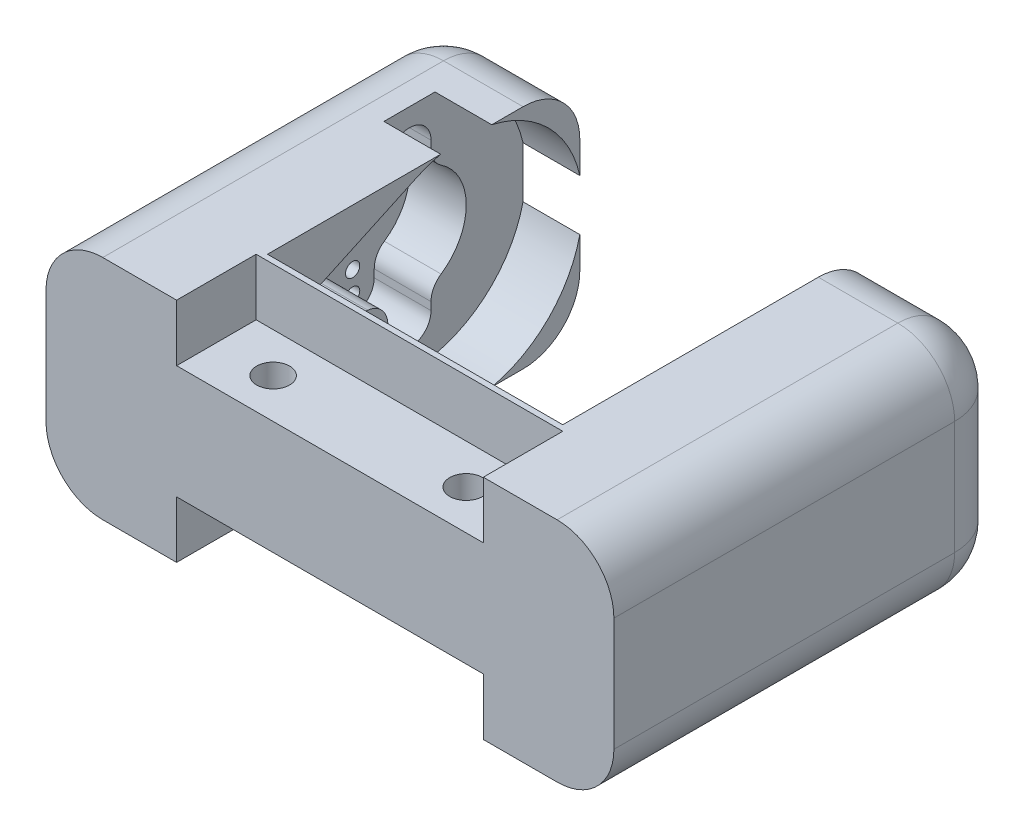
from build123d import *

# Parameters (mm, degrees)
EXTRUDE_1_DEPTH     = 20
FILLET_1_R          = 5
SKETCH_2_R          = 8
CUT_EXTRUDE_1_DEPTH = 5
SKETCH_3_R          = 6
CUT_EXTRUDE_2_DEPTH = 1
CUT_EXTRUDE_3_DEPTH = 5
CUT_EXTRUDE_4_DEPTH = 5
SKETCH_6_R          = 0.625
CUT_EXTRUDE_5_DEPTH = 4
SKETCH_7_W          = 27
SKETCH_7_H          = 5
CUT_EXTRUDE_6_DEPTH = 7
SKETCH_8_R          = 1.45
CUT_EXTRUDE_7_DEPTH = 12


with BuildPart() as part:
    # Эскиз1 → Бобышка-Вытянуть1 (new body)
    with BuildSketch(Plane(origin=(0, 0, 0), x_dir=(1, 0, 0), z_dir=(0, 1, 0))):
        Polygon((-13, 27.5), (-13, 0), (13, 0), (13, 27.5), (25, 27.5), (25, -7.5), (-25, -7.5), (-25, 27.5), align=None)
    extrude(amount=EXTRUDE_1_DEPTH)

    # Скругление1
    fillet_1_edges = [part.edges().sort_by_distance(p)[0] for p in [
        (25, 0, -10),
        (25, 20, -10),
        (-25, 20, -10),
        (-25, 0, -10),
        (19, 20, -27.5),
        (25, 10, -27.5),
        (19, 0, -27.5),
        (-25, 10, -27.5),
        (-19, 20, -27.5),
        (-19, 0, -27.5),
    ]]
    fillet(fillet_1_edges, radius=FILLET_1_R)

    # Эскиз2 → Вырез-Вытянуть1 (cut)
    with BuildSketch(Plane.ZY.offset(-13)):
        with Locations((-17.5, 10)):
            Circle(SKETCH_2_R)
    extrude(amount=-CUT_EXTRUDE_1_DEPTH, mode=Mode.SUBTRACT)

    # Эскиз3 → Вырез-Вытянуть2 (cut)
    with BuildSketch(Plane.ZY.offset(-18)):
        with Locations((-17.5, 10)):
            Circle(SKETCH_3_R)
    extrude(amount=-CUT_EXTRUDE_2_DEPTH, mode=Mode.SUBTRACT)

    # Эскиз4 → Вырез-Вытянуть3 (cut)
    with BuildSketch(Plane(origin=(-13, 0, 0), x_dir=(0, 0, -1), z_dir=(1, 0, 0))):
        with BuildLine():
            Line((13.195, 19.30212207), (2.9, 14.537620522))
            ThreePointArc((2.9, 14.537620522), (0, 10), (2.9, 5.462379478))
            Line((2.9, 5.462379478), (13.195, 0.69787793))
            ThreePointArc((13.195, 0.69787793), (27.75, 10), (13.195, 19.30212207))
        make_face()
    extrude(amount=-CUT_EXTRUDE_3_DEPTH, mode=Mode.SUBTRACT)

    # Эскиз5 → Вырез-Вытянуть4 (cut)
    with BuildSketch(Plane(origin=(-18, 0, 0), x_dir=(0, 0, -1), z_dir=(1, 0, 0))):
        with BuildLine():
            Line((19.4, 15.812916652), (19.4, 16.49838717))
            ThreePointArc((19.4, 16.49838717), (17.499999842, 18.39838717), (15.6, 16.498386854))
            Line((15.6, 16.498386854), (15.6, 15.665366642))
            ThreePointArc((15.6, 15.665366642), (15.094249889, 14.335999398), (13.832782732, 13.678959785))
            Line((13.832782732, 13.678959785), (1.932299859, 12.284367885))
            ThreePointArc((1.932299859, 12.284367885), (-0.1, 10), (1.932299859, 7.715632115))
            Line((1.932299859, 7.715632115), (13.832782732, 6.321040215))
            ThreePointArc((13.832782732, 6.321040215), (15.094249889, 5.664000602), (15.6, 4.334633358))
            Line((15.6, 4.334633358), (15.6, 3.501613146))
            ThreePointArc((15.6, 3.501613146), (17.5, 1.601613146), (19.4, 3.501613146))
            Line((19.4, 3.501613146), (19.4, 4.187083665))
            ThreePointArc((19.4, 4.187083665), (19.635266181, 5.128207436), (20.285714286, 5.847916677))
            ThreePointArc((20.285714286, 5.847916677), (22.5, 10), (20.285714286, 14.152083323))
            ThreePointArc((20.285714286, 14.152083323), (19.635266107, 14.871792704), (19.4, 15.812916652))
        make_face()
    extrude(amount=-CUT_EXTRUDE_4_DEPTH, mode=Mode.SUBTRACT)

    # Эскиз6 → Вырез-Вытянуть5 (cut)
    with BuildSketch(Plane(origin=(-23, 0, 0), x_dir=(0, 0, -1), z_dir=(1, 0, 0))):
        with Locations((2.278018202, 10)):
            Circle(SKETCH_6_R)
        with Locations((6.311115384, 10)):
            Circle(SKETCH_6_R)
        with Locations((10.428235425, 10)):
            Circle(SKETCH_6_R)
        with Locations((17.5, 14.907931149)):
            Circle(SKETCH_6_R)
        with Locations((17.5, 16.848859168)):
            Circle(SKETCH_6_R)
        with Locations((17.5, 5.082068851)):
            Circle(SKETCH_6_R)
        with Locations((17.5, 3.141140832)):
            Circle(SKETCH_6_R)
    extrude(amount=-CUT_EXTRUDE_5_DEPTH, mode=Mode.SUBTRACT)

    # Эскиз7 → Вырез-Вытянуть6 (cut)
    with BuildSketch(Plane.XY.offset(7.5)):
        with Locations((0, 17.5)):
            Rectangle(SKETCH_7_W, SKETCH_7_H)
        with Locations((0, 2.5)):
            Rectangle(SKETCH_7_W, SKETCH_7_H)
    extrude(amount=-CUT_EXTRUDE_6_DEPTH, mode=Mode.SUBTRACT)

    # Эскиз8 → Вырез-Вытянуть7 (cut)
    with BuildSketch(Plane(origin=(0, 15, 0), x_dir=(1, 0, 0), z_dir=(0, 1, 0))):
        with Locations((-8.5, -4)):
            Circle(SKETCH_8_R)
        with Locations((8.5, -4)):
            Circle(SKETCH_8_R)
    extrude(amount=-CUT_EXTRUDE_7_DEPTH, mode=Mode.SUBTRACT)


solid = part.part
